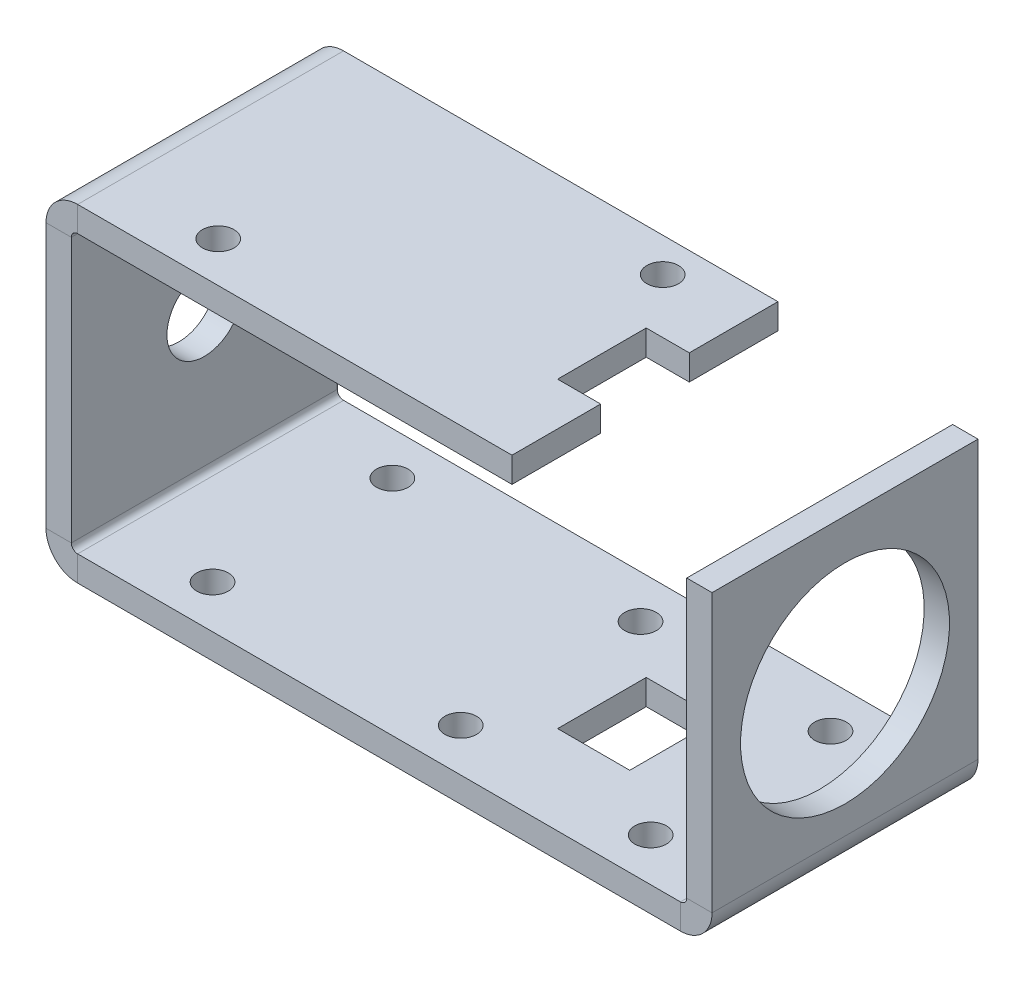
from build123d import *

# Parameters (mm, degrees)
SKETCH1_W                    = 52.6
SKETCH1_H                    = 21
BASE_FLANGE1_DEPTH           = 2
EDGE_FLANGE1_STRIP_W         = 9
EDGE_FLANGE1_STRIP_H         = 2
EDGE_FLANGE1_STRIP_CUT_DEPTH = 21
EDGE_FLANGE1_DEPTH           = 21
EDGE_FLANGE2_STRIP_W         = 9
EDGE_FLANGE2_STRIP_H         = 2
EDGE_FLANGE2_STRIP_CUT_DEPTH = 21
EDGE_FLANGE2_DEPTH           = 21
EDGE_FLANGE3_STRIP_W         = 9
EDGE_FLANGE3_STRIP_H         = 2
EDGE_FLANGE3_STRIP_CUT_DEPTH = 21
EDGE_FLANGE3_DEPTH           = 21
SKETCH15_W                   = 3.4
SKETCH15_H                   = 7
CUT_EXTRUDE1_DEPTH           = 10
SKETCH16_R                   = 1.25
CUT_EXTRUDE2_DEPTH           = 2
SKETCH18_W                   = 5.7
SKETCH18_H                   = 7
CUT_EXTRUDE3_DEPTH           = 39.376425055
SKETCH19_R                   = 2.95
CUT_EXTRUDE4_DEPTH           = 2
SKETCH20_R                   = 1.25
CUT_EXTRUDE5_DEPTH           = 2
SKETCH21_R                   = 8.25
CUT_EXTRUDE6_DEPTH           = 2
MOVE_FACE1_BY                = 0.8


# Sheet-metal steps are written as plain solids
with BuildPart() as part:
    # Sketch1 → Base-Flange1 (new body)
    with BuildSketch(Plane(origin=(0, 0, 0), x_dir=(1, 0, 0), z_dir=(0, 1, 0))):
        Rectangle(SKETCH1_W, SKETCH1_H)
    extrude(amount=-BASE_FLANGE1_DEPTH)

    # Edge-Flange1 strip (across the edge) → Edge-Flange1 strip cut (cut)
    with BuildSketch(Plane(origin=(-26.3, 0, -10.5), x_dir=(1, 0, 0), z_dir=(0, 0, 1))):
        with Locations((-2, -1)):
            Rectangle(EDGE_FLANGE1_STRIP_W, EDGE_FLANGE1_STRIP_H)
    extrude(amount=EDGE_FLANGE1_STRIP_CUT_DEPTH, mode=Mode.SUBTRACT)

    # Edge-Flange1 section (across the edge) → Edge-Flange1 (add)
    with BuildSketch(Plane(origin=(-26.3, 0, -10.5), x_dir=(1, 0, 0), z_dir=(0, 0, 1))):
        with BuildLine():
            Line((0, 0.5), (0, 23.9))
            Line((0, 23.9), (2, 23.9))
            Line((2, 23.9), (2, 0.5))
            ThreePointArc((2, 0.5), (2.146446609, 0.146446609), (2.5, 0))
            Line((2.5, 0), (2.5, -2))
            ThreePointArc((2.5, -2), (0.732233047, -1.267766953), (0, 0.5))
        make_face()
    extrude(amount=EDGE_FLANGE1_DEPTH)

    # Edge-Flange2 strip (across the edge) → Edge-Flange2 strip cut (cut)
    with BuildSketch(Plane(origin=(-24.3, 23.9, -10.5), x_dir=(0, -1, 0), z_dir=(0, 0, 1))):
        with Locations((-2, -1)):
            Rectangle(EDGE_FLANGE2_STRIP_W, EDGE_FLANGE2_STRIP_H)
    extrude(amount=EDGE_FLANGE2_STRIP_CUT_DEPTH, mode=Mode.SUBTRACT)

    # Edge-Flange2 section (across the edge) → Edge-Flange2 (add)
    with BuildSketch(Plane(origin=(-24.3, 23.9, -10.5), x_dir=(0, -1, 0), z_dir=(0, 0, 1))):
        with BuildLine():
            Line((0, 0.5), (0, 34.8))
            Line((0, 34.8), (2, 34.8))
            Line((2, 34.8), (2, 0.5))
            ThreePointArc((2, 0.5), (2.146446609, 0.146446609), (2.5, 0))
            Line((2.5, 0), (2.5, -2))
            ThreePointArc((2.5, -2), (0.732233047, -1.267766953), (0, 0.5))
        make_face()
    extrude(amount=EDGE_FLANGE2_DEPTH)

    # Edge-Flange3 strip (across the edge) → Edge-Flange3 strip cut (cut)
    with BuildSketch(Plane(origin=(26.3, 0, 10.5), x_dir=(-1, 0, 0), z_dir=(0, 0, -1))):
        with Locations((-2, -1)):
            Rectangle(EDGE_FLANGE3_STRIP_W, EDGE_FLANGE3_STRIP_H)
    extrude(amount=EDGE_FLANGE3_STRIP_CUT_DEPTH, mode=Mode.SUBTRACT)

    # Edge-Flange3 section (across the edge) → Edge-Flange3 (add)
    with BuildSketch(Plane(origin=(26.3, 0, 10.5), x_dir=(-1, 0, 0), z_dir=(0, 0, -1))):
        with BuildLine():
            Line((0, 0.5), (0, 21.6))
            Line((0, 21.6), (2, 21.6))
            Line((2, 21.6), (2, 0.5))
            ThreePointArc((2, 0.5), (2.146446609, 0.146446609), (2.5, 0))
            Line((2.5, 0), (2.5, -2))
            ThreePointArc((2.5, -2), (0.732233047, -1.267766953), (0, 0.5))
        make_face()
    extrude(amount=EDGE_FLANGE3_DEPTH)

    # Sketch15 → Cut-Extrude1 (cut)
    with BuildSketch(Plane(origin=(0, 23.9, 0), x_dir=(1, 0, 0), z_dir=(0, 1, 0))):
        with Locations((8.8, 0)):
            Rectangle(SKETCH15_W, SKETCH15_H)
    extrude(amount=-CUT_EXTRUDE1_DEPTH, mode=Mode.SUBTRACT)

    # Sketch16 → Cut-Extrude2 (cut)
    with BuildSketch(Plane(origin=(0, 23.9, 0), x_dir=(1, 0, 0), z_dir=(0, 1, 0))):
        with Locations(Location((4.1, 7.8, 0), (0, 0, 180))):
            Circle(SKETCH16_R)
        with Locations(Location((-15.9, -7.3, 0), (0, 0, 180))):
            Circle(SKETCH16_R)
    extrude(amount=-CUT_EXTRUDE2_DEPTH, mode=Mode.SUBTRACT)

    # Sketch18 → Cut-Extrude3 (cut, through all)
    with BuildSketch(Plane(origin=(0, 23.9, 0), x_dir=(1, 0, 0), z_dir=(0, 1, 0))):
        with Locations((9.95, 0)):
            Rectangle(SKETCH18_W, SKETCH18_H)
    extrude(amount=-CUT_EXTRUDE3_DEPTH, mode=Mode.SUBTRACT)

    # Sketch19 → Cut-Extrude4 (cut)
    with BuildSketch(Plane.ZY.offset(26.3)):
        with Locations(Location((0, 10.95, 0), (0, 0, 270))):
            Circle(SKETCH19_R)
    extrude(amount=-CUT_EXTRUDE4_DEPTH, mode=Mode.SUBTRACT)

    # Sketch20 → Cut-Extrude5 (cut)
    with BuildSketch(Plane.XZ.offset(2)):
        with Locations(Location((-16.55, 7.1, 0), (0, 0, 270))):
            Circle(SKETCH20_R)
        with Locations(Location((3.05, 7.1, 0), (0, 0, 270))):
            Circle(SKETCH20_R)
        with Locations(Location((18.05, 7.1, 0), (0, 0, 270))):
            Circle(SKETCH20_R)
        with Locations(Location((-16.55, -7.1, 0), (0, 0, 270))):
            Circle(SKETCH20_R)
        with Locations(Location((3.05, -7.1, 0), (0, 0, 270))):
            Circle(SKETCH20_R)
        with Locations(Location((18.05, -7.1, 0), (0, 0, 270))):
            Circle(SKETCH20_R)
    extrude(amount=-CUT_EXTRUDE5_DEPTH, mode=Mode.SUBTRACT)

    # Sketch21 → Cut-Extrude6 (cut)
    with BuildSketch(Plane(origin=(26.3, 0, 0), x_dir=(0, 0, -1), z_dir=(1, 0, 0))):
        with Locations(Location((0, 10.95, 0), (0, 0, 90))):
            Circle(SKETCH21_R)
    extrude(amount=-CUT_EXTRUDE6_DEPTH, mode=Mode.SUBTRACT)

    # Move Face1: a face moved outward by 0.8
    extrude(part.faces().sort_by_distance((25.3, 21.6, 0))[0], amount=MOVE_FACE1_BY, dir=(0, 1, 0))


solid = part.part
